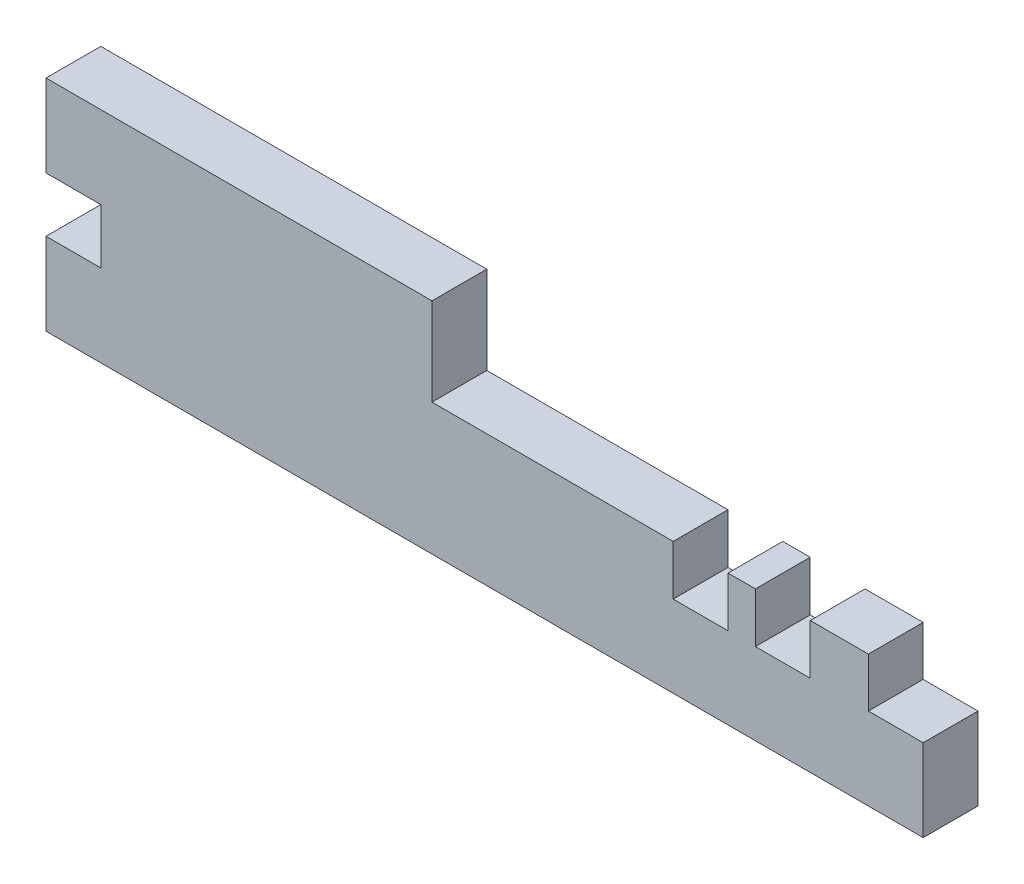
from build123d import *

# Parameters (mm, degrees)
BOSS_EXTRU_1_DEPTH = 5


with BuildPart() as part:
    # Esquisse1 → Boss.-Extru.1 (new body)
    with BuildSketch(Plane.XY):
        Polygon((0, 0), (30.2, 0), (70, 0), (75, 0), (75, 7.5), (70, 7.5), (70, 12), (64.7, 12), (64.7, 7.440850489), (59.7, 7.440850489), (59.7, 12), (57.2, 12), (57.2, 7.440850489), (52.2, 7.440850489), (52.2, 12), (30.2, 12), (30.2, 20), (0, 20), (-5, 20), (-5, 12.5), (0, 12.5), (0, 7.5), (-5, 7.5), (-5, 0), align=None)
    extrude(amount=BOSS_EXTRU_1_DEPTH)


solid = part.part
